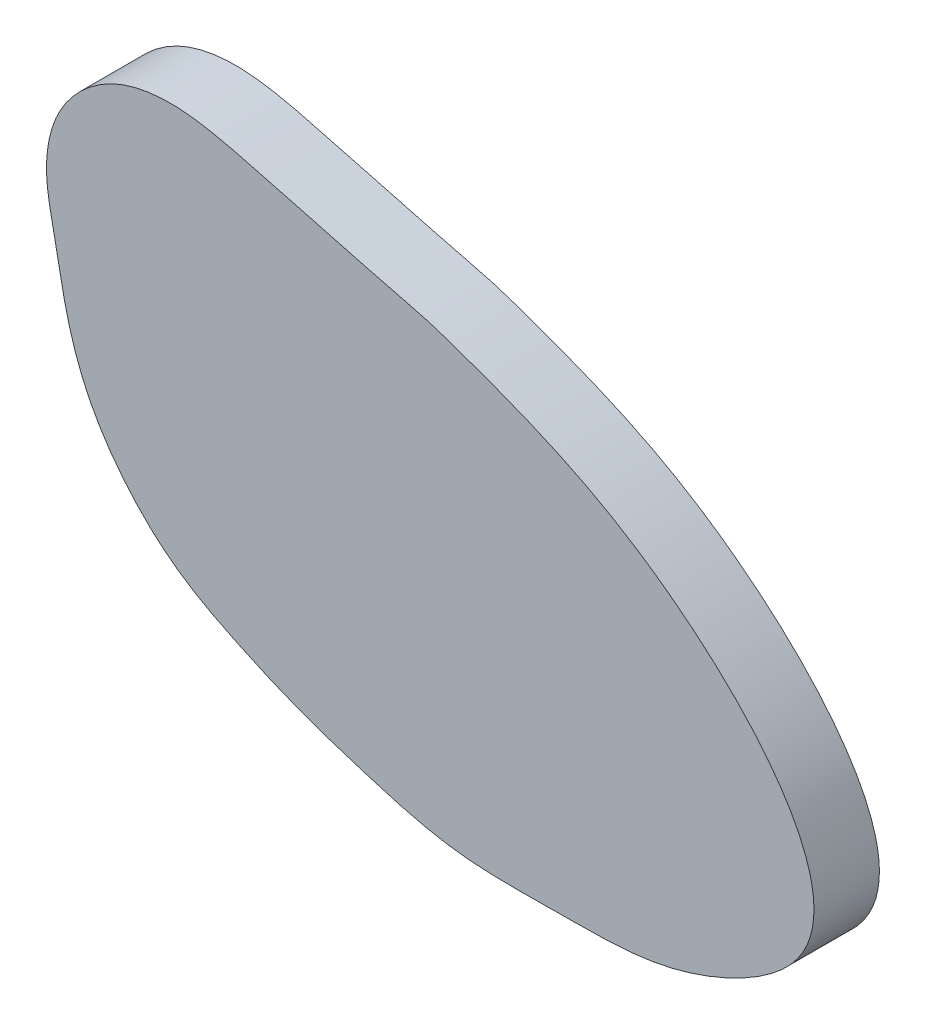
from build123d import *

# Parameters (mm, degrees)
BOSS_EXTRUDE1_DEPTH = 6.35


with BuildPart() as part:
    # 3DSketch1 → Boss-Extrude1 (new body)
    with BuildSketch(Plane(origin=(30.032962799, 0, 0), x_dir=(-0.9987048804494961, 0.05087791039692654, 0), z_dir=(0, 0, 1))):
        with BuildLine():
            add(Edge.make_bspline(
                [(0, 0), (5.728412, -3.324431564), (12.528173448, -5.636415436), (20.881556122, -8.079016443), (24.413253381, -8.676334849), (26.903150246, -9.225398606), (29.397372039, -9.755129715), (31.895325701, -10.271474034), (35.398242189, -10.999247532), (39.863330919, -11.972525448), (45.466262132, -12.878689441), (52.092356183, -11.478605177), (56.97635345, -6.271527648), (57.623398292, 0), (56.047115943, 5.396672541), (54.89040149, 10.876745503), (52.586763737, 16.612688755), (48.651265226, 21.977642882), (43.60751493, 26.416747732), (37.542680662, 29.182634345), (31.381347684, 31.57787605), (23.916977177, 33.569019776), (15.601547039, 35.482688348), (4.846081, 34.59360478), (-5.223534115, 34.388535532), (-27.206838911, 22.262470542), (-10.979456334, 6.371827164), (0, 0)],
                knots=[0, 0, 0, 0, 0.09375, 0.1171875, 0.1328125, 0.1484375, 0.15625, 0.171875, 0.1875, 0.2109375, 0.2421875, 0.2734375, 0.3125, 0.34375, 0.3671875, 0.3984375, 0.4296875, 0.4609375, 0.5, 0.53125, 0.5625, 0.6015625, 0.6484375, 0.6953125, 0.7578125, 0.8203125, 1, 1, 1, 1], degree=3))
        make_face()
    extrude(amount=BOSS_EXTRUDE1_DEPTH)


solid = part.part
